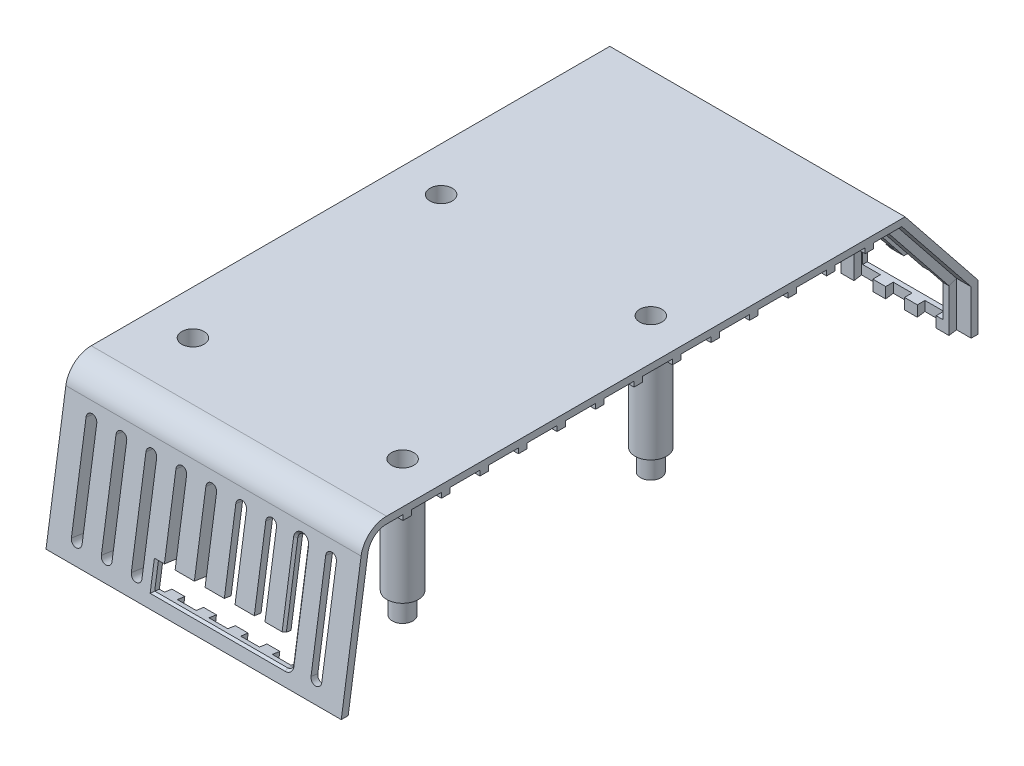
from build123d import *
from OCP.BRepFilletAPI import BRepFilletAPI_MakeChamfer

# Parameters (mm, degrees)
EXTRUDE_1_DEPTH      = 69
SKETCH_7_W           = 3
SKETCH_7_H           = 1.8
SKETCH_18_R          = 3.7
EXTRUDE_2_DEPTH      = 30
EXTRUDE_START        = -69
SKETCH_28_W          = 2
SKETCH_28_H          = 1.2
EXTRUDE_3_DEPTH      = 69
SKETCH_27_R          = 2.6
CUT_EXTRUDE_6_DEPTH  = 25
CUT_EXTRUDE_7_REACH  = 169.39
SKETCH_29_R          = 1.35
SKETCH_30_R          = 4
SKETCH_30_R_2        = 2.4
CUT_EXTRUDE_8_DEPTH  = 5
CUT_EXTRUDE_9_REACH  = 177.052
CUT_EXTRUDE_10_REACH = 164.542
CUT_EXTRUDE_START    = -3.379506
SKETCH_33_W          = 31.085842881
SKETCH_33_H          = 6.2
CUT_EXTRUDE_11_DEPTH = 3.379506
CUT_EXTRUDE_12_REACH = 170.6
SKETCH_34_W          = 20.5
SKETCH_34_H          = 11.5
CHAMFER_1_SIZE       = 0.5
CHAMFER_1_SIZE2      = 0.355745443


with BuildPart() as part:
    # 草图2 → 凸台-拉伸1 (new body)
    with BuildSketch(Plane(origin=(0, 0, 0), x_dir=(0, 0, -1), z_dir=(1, 0, 0))):
        with BuildLine():
            Line((-2.001625282, 6.75), (-2.001625282, 17.164444968))
            Line((-2.001625282, 17.164444968), (-18.214026207, 37.447074334))
            Line((-18.214026207, 37.447074334), (-138.628938569, 37.447074334))
            ThreePointArc((-138.628938569, 37.447074334), (-141.499289796, 36.38190324), (-142.979906861, 33.70211244))
            Line((-142.979906861, 33.70211244), (-147.037546338, 6.75))
            Line((-147.037546338, 6.75), (-147.579526198, 3.15))
            Line((-147.579526198, 3.15), (-149.197556836, 3.15))
            Line((-149.197556836, 3.15), (-148.655576976, 6.75))
            Line((-148.655576976, 6.75), (-144.562077149, 33.940308116))
            ThreePointArc((-144.562077149, 33.940308116), (-142.543053879, 37.594568297), (-138.628938569, 39.047074334))
            Line((-138.628938569, 39.047074334), (-17.444620599, 39.047074334))
            Line((-17.444620599, 39.047074334), (-0.401625282, 17.725324466))
            Line((-0.401625282, 17.725324466), (-0.401625282, 6.75))
            Line((-0.401625282, 6.75), (-2.001625282, 6.75))
        make_face()
    extrude(amount=EXTRUDE_1_DEPTH)

    # 扫描1: sweep along a path in 草图17
    with BuildLine(Plane.ZY) as sweep_1_path:
        Line((147.579526198, 3.15), (143.056789207, 33.191435819))
        ThreePointArc((143.056789207, 33.191435819), (141.374269815, 36.236652636), (138.112507057, 37.447074334))
        Line((138.112507057, 37.447074334), (18.214026207, 37.447074334))
        Line((18.214026207, 37.447074334), (2.001625282, 17.164444968))
        Line((2.001625282, 17.164444968), (2.001625282, 6.75))
    # 草图7 → 扫描1 (sweep)
    with BuildSketch(Plane.XZ.offset(-3.15)):
        with Locations((34.5, 146.679966657)):
            Rectangle(SKETCH_7_W, SKETCH_7_H)
        with Locations((27.1, 146.679966657)):
            Rectangle(SKETCH_7_W, SKETCH_7_H)
        with Locations((19.7, 146.679966657)):
            Rectangle(SKETCH_7_W, SKETCH_7_H)
        with Locations((12.3, 146.679966657)):
            Rectangle(SKETCH_7_W, SKETCH_7_H)
        with Locations((4.9, 146.679966657)):
            Rectangle(SKETCH_7_W, SKETCH_7_H)
        with Locations((41.9, 146.679966657)):
            Rectangle(SKETCH_7_W, SKETCH_7_H)
        with Locations((49.3, 146.679966657)):
            Rectangle(SKETCH_7_W, SKETCH_7_H)
        with Locations((56.7, 146.679966657)):
            Rectangle(SKETCH_7_W, SKETCH_7_H)
        with Locations((64.1, 146.679966657)):
            Rectangle(SKETCH_7_W, SKETCH_7_H)
    sweep(path=sweep_1_path.line, transition=Transition.RIGHT)

    # 草图18 → 凸台-拉伸2 (add)
    with BuildSketch(Plane.XZ.offset(-37.447074334)):
        with Locations(Location((59.3, 67.161625282, 0), (0, 0, 107.295344629))):
            Circle(SKETCH_18_R)
        with Locations(Location((59.3, 125.161625282, 0), (0, 0, 107.295344629))):
            Circle(SKETCH_18_R)
        with Locations(Location((10.3, 125.161625282, 0), (0, 0, 82.233565831))):
            Circle(SKETCH_18_R)
        with Locations(Location((10.3, 67.161625282, 0), (0, 0, 82.233565831))):
            Circle(SKETCH_18_R)
    extrude(amount=EXTRUDE_2_DEPTH)

    # 草图28 → 凸台-拉伸3 (add)
    with BuildSketch(Plane(origin=(69, 0, 0), x_dir=(0, 0, -1), z_dir=(1, 0, 0)).offset(EXTRUDE_START)):
        with Locations((-133.786467665, 36.847074334)):
            Rectangle(SKETCH_28_W, SKETCH_28_H)
        with Locations((-124.786467665, 36.847074334)):
            Rectangle(SKETCH_28_W, SKETCH_28_H)
        with Locations((-115.786467665, 36.847074334)):
            Rectangle(SKETCH_28_W, SKETCH_28_H)
        with Locations((-106.786467665, 36.847074334)):
            Rectangle(SKETCH_28_W, SKETCH_28_H)
        with Locations((-97.786467665, 36.847074334)):
            Rectangle(SKETCH_28_W, SKETCH_28_H)
        with Locations((-88.786467665, 36.847074334)):
            Rectangle(SKETCH_28_W, SKETCH_28_H)
        with Locations((-79.786467665, 36.847074334)):
            Rectangle(SKETCH_28_W, SKETCH_28_H)
        with Locations((-70.786467665, 36.847074334)):
            Rectangle(SKETCH_28_W, SKETCH_28_H)
        with Locations((-61.786467665, 36.847074334)):
            Rectangle(SKETCH_28_W, SKETCH_28_H)
        with Locations((-52.786467665, 36.847074334)):
            Rectangle(SKETCH_28_W, SKETCH_28_H)
        with Locations((-43.786467665, 36.847074334)):
            Rectangle(SKETCH_28_W, SKETCH_28_H)
        with Locations((-34.786467665, 36.847074334)):
            Rectangle(SKETCH_28_W, SKETCH_28_H)
        with Locations((-25.786467665, 36.847074334)):
            Rectangle(SKETCH_28_W, SKETCH_28_H)
    extrude(amount=EXTRUDE_3_DEPTH)

    # 草图27 → 切除-拉伸6 (cut)
    with BuildSketch(Plane(origin=(0, 39.047074334, 0), x_dir=(1, 0, 0), z_dir=(0, 1, 0))):
        with Locations(Location((10.3, -67.161625282, 0), (0, 0, 270))):
            Circle(SKETCH_27_R)
        with Locations(Location((59.3, -125.161625282, 0), (0, 0, 270))):
            Circle(SKETCH_27_R)
        with Locations(Location((10.3, -125.161625282, 0), (0, 0, 270))):
            Circle(SKETCH_27_R)
        with Locations(Location((59.3, -67.161625282, 0), (0, 0, 270))):
            Circle(SKETCH_27_R)
    extrude(amount=-CUT_EXTRUDE_6_DEPTH, mode=Mode.SUBTRACT)

    # 草图29 → 切除-拉伸7 (cut, up to next)
    with BuildSketch(Plane.XZ.offset(-7.447074334), mode=Mode.PRIVATE) as cut_extrude_7_sk1:
        with Locations(Location((59.3, 67.161625282, 0), (0, 0, 270))):
            Circle(SKETCH_29_R)
    cut_extrude_7_tool1 = extrude(cut_extrude_7_sk1.sketch, amount=-CUT_EXTRUDE_7_REACH, mode=Mode.PRIVATE) & part.part
    # 草图29 → 切除-拉伸7 (cut, up to next)
    with BuildSketch(Plane.XZ.offset(-7.447074334), mode=Mode.PRIVATE) as cut_extrude_7_sk2:
        with Locations(Location((10.3, 67.161625282, 0), (0, 0, 270))):
            Circle(SKETCH_29_R)
    cut_extrude_7_tool2 = extrude(cut_extrude_7_sk2.sketch, amount=-CUT_EXTRUDE_7_REACH, mode=Mode.PRIVATE) & part.part
    # 草图29 → 切除-拉伸7 (cut, up to next)
    with BuildSketch(Plane.XZ.offset(-7.447074334), mode=Mode.PRIVATE) as cut_extrude_7_sk3:
        with Locations(Location((10.3, 125.161625282, 0), (0, 0, 270))):
            Circle(SKETCH_29_R)
    cut_extrude_7_tool3 = extrude(cut_extrude_7_sk3.sketch, amount=-CUT_EXTRUDE_7_REACH, mode=Mode.PRIVATE) & part.part
    # 草图29 → 切除-拉伸7 (cut, up to next)
    with BuildSketch(Plane.XZ.offset(-7.447074334), mode=Mode.PRIVATE) as cut_extrude_7_sk4:
        with Locations(Location((59.3, 125.161625282, 0), (0, 0, 270))):
            Circle(SKETCH_29_R)
    cut_extrude_7_tool4 = extrude(cut_extrude_7_sk4.sketch, amount=-CUT_EXTRUDE_7_REACH, mode=Mode.PRIVATE) & part.part
    add(cut_extrude_7_tool1.solids().sort_by_distance((59.3, 7.447074, 67.161625))[0], mode=Mode.SUBTRACT)
    add(cut_extrude_7_tool2.solids().sort_by_distance((10.3, 7.447074, 67.161625))[0], mode=Mode.SUBTRACT)
    add(cut_extrude_7_tool3.solids().sort_by_distance((10.3, 7.447074, 125.161625))[0], mode=Mode.SUBTRACT)
    add(cut_extrude_7_tool4.solids().sort_by_distance((59.3, 7.447074, 125.161625))[0], mode=Mode.SUBTRACT)

    # 草图30 → 切除-拉伸8 (cut)
    # profile 1 of 4: a face of its own
    with BuildSketch(Plane.XZ.offset(-7.447074334)):
        with Locations((59.3, 67.161625282)):
            Circle(SKETCH_30_R)
        with Locations(Location((59.3, 67.161625282, 0), (0, 0, 270))):
            Circle(SKETCH_30_R_2, mode=Mode.SUBTRACT)
    # profile 2 of 4: a face of its own
    with BuildSketch(Plane.XZ.offset(-7.447074334)):
        with Locations((10.3, 67.161625282)):
            Circle(SKETCH_30_R)
        with Locations(Location((10.3, 67.161625282, 0), (0, 0, 270))):
            Circle(SKETCH_30_R_2, mode=Mode.SUBTRACT)
    # profile 3 of 4: a face of its own
    with BuildSketch(Plane.XZ.offset(-7.447074334)):
        with Locations((10.3, 125.161625282)):
            Circle(SKETCH_30_R)
        with Locations(Location((10.3, 125.161625282, 0), (0, 0, 270))):
            Circle(SKETCH_30_R_2, mode=Mode.SUBTRACT)
    # profile 4 of 4: a face of its own
    with BuildSketch(Plane.XZ.offset(-7.447074334)):
        with Locations((59.3, 125.161625282)):
            Circle(SKETCH_30_R)
        with Locations(Location((59.3, 125.161625282, 0), (0, 0, 270))):
            Circle(SKETCH_30_R_2, mode=Mode.SUBTRACT)
    extrude(amount=-CUT_EXTRUDE_8_DEPTH, mode=Mode.SUBTRACT)

    # 草图31 → 切除-拉伸9 (cut, up to next)
    with BuildSketch(Plane(origin=(0, 6.714196053, -8.399838534), x_dir=(-1, 0, 0), z_dir=(0, 0.624373217491497, -0.7811261647642562)), mode=Mode.PRIVATE) as cut_extrude_9_sk1:
        Polygon((-56.770892384, 34.156163026), (-54.232430846, 34.156163026), (-51.725219307, 30.302797642), (-49.213200076, 34.156163026), (-46.672334692, 34.156163026), (-50.455988538, 28.353278411), (-46.422334692, 22.156163026), (-48.96079623, 22.156163026), (-51.725219307, 26.406163026), (-54.496853923, 22.156163026), (-57.037719307, 22.156163026), (-52.994450076, 28.355682257), align=None)
    cut_extrude_9_tool1 = extrude(cut_extrude_9_sk1.sketch, amount=-CUT_EXTRUDE_9_REACH, mode=Mode.PRIVATE) & part.part
    # 草图31 → 切除-拉伸9 (cut, up to next)
    with BuildSketch(Plane(origin=(0, 6.714196053, -8.399838534), x_dir=(-1, 0, 0), z_dir=(0, 0.624373217491497, -0.7811261647642562)), mode=Mode.PRIVATE) as cut_extrude_9_sk2:
        Polygon((-39.24204623, 34.156163026), (-37.006469307, 34.156163026), (-34.268488538, 25.785970719), (-31.511277, 34.156163026), (-29.297334692, 34.156163026), (-27.268488538, 22.156163026), (-29.448777, 22.156163026), (-30.730027, 29.735489949), (-33.225219307, 22.156163026), (-35.326180846, 22.156163026), (-37.806950076, 29.735489949), (-39.08579623, 22.156163026), (-41.268488538, 22.156163026), align=None)
    cut_extrude_9_tool2 = extrude(cut_extrude_9_sk2.sketch, amount=-CUT_EXTRUDE_9_REACH, mode=Mode.PRIVATE) & part.part
    # 草图31 → 切除-拉伸9 (cut, up to next)
    with BuildSketch(Plane(origin=(0, 6.714196053, -8.399838534), x_dir=(-1, 0, 0), z_dir=(0, 0.624373217491497, -0.7811261647642562)), mode=Mode.PRIVATE) as cut_extrude_9_sk3:
        with BuildLine():
            Line((-20.653103923, 34.156163026), (-18.499257769, 34.156163026))
            Line((-18.499257769, 34.156163026), (-18.499257769, 26.348470719))
            add(Edge.make_bspline(
                [(-18.499257769, 26.348470719), (-18.499140653, 26.267523951), (-18.498914446, 26.111176106), (-18.487590384, 25.886868138), (-18.477228086, 25.680682149), (-18.458531559, 25.492843871), (-18.430910381, 25.323272952), (-18.404164068, 25.170880129), (-18.367965578, 25.038393824), (-18.313565035, 24.887589722), (-18.229751655, 24.718153077), (-18.092805244, 24.541562319), (-17.934780801, 24.380397621), (-17.745379404, 24.246250232), (-17.532508984, 24.137737086), (-17.29733917, 24.057340854), (-17.040201466, 24.012651223), (-16.862404849, 24.005828532), (-16.770892384, 24.002316872)],
                knots=[0, 0, 0, 0, 1.155499968, 2.231836252, 3.205919964, 4.102923608, 4.924856345, 5.658536265, 6.31071849, 6.882491295, 7.94666036, 8.992281882, 10.060072772, 11.158554251, 12.289267114, 13.461410017, 14.693379945, 16, 16, 16, 16], degree=3))
            add(Edge.make_bspline(
                [(-16.770892384, 24.002316872), (-16.673671684, 24.005153843), (-16.484107778, 24.010685455), (-16.211450278, 24.064984213), (-15.958831557, 24.151446433), (-15.731600417, 24.274850057), (-15.529982988, 24.422770926), (-15.359318059, 24.591447071), (-15.224629924, 24.781214917), (-15.136845208, 24.956290205), (-15.087558414, 25.117431762), (-15.050615506, 25.261405629), (-15.023532267, 25.43128054), (-14.998961463, 25.624403533), (-14.984196303, 25.842774989), (-14.968185894, 26.084638738), (-14.96231793, 26.351649676), (-14.961317779, 26.537574403), (-14.96079623, 26.634528411)],
                knots=[0, 0, 0, 0, 1.261321664, 2.459363699, 3.594844139, 4.716940403, 5.803436589, 6.833651888, 7.818396249, 8.814403945, 9.360733334, 10.004355033, 10.743453831, 11.592799886, 12.532235708, 13.585170094, 14.740740724, 16, 16, 16, 16], degree=3))
            Line((-14.96079623, 26.634528411), (-14.96079623, 34.156163026))
            Line((-14.96079623, 34.156163026), (-12.806950076, 34.156163026))
            Line((-12.806950076, 34.156163026), (-12.806950076, 26.99750918))
            add(Edge.make_bspline(
                [(-12.806950076, 26.99750918), (-12.807249177, 26.852475195), (-12.807824319, 26.573588987), (-12.816656757, 26.17280988), (-12.835459422, 25.806762454), (-12.851251491, 25.47533975), (-12.881814553, 25.17898825), (-12.913654094, 24.916442448), (-12.954236328, 24.688632747), (-13.014620253, 24.429299087), (-13.11882503, 24.130685876), (-13.286816792, 23.786845707), (-13.50007146, 23.450205355), (-13.752127821, 23.124468094), (-14.036722509, 22.821868677), (-14.34754545, 22.556225557), (-14.679658441, 22.331520122), (-15.036531824, 22.153246692), (-15.417861882, 22.014206856), (-15.827421591, 21.920779089), (-16.264931663, 21.857658117), (-16.56712814, 21.851594571), (-16.722815461, 21.848470719)],
                knots=[0, 0, 0, 0, 1.170808336, 2.251350247, 3.235597562, 4.129743112, 4.929140599, 5.639994148, 6.264258765, 6.79612947, 7.788252245, 8.809469599, 9.879094798, 10.999557536, 12.129761673, 13.226370002, 14.293821979, 15.358369427, 16.438775801, 17.562147481, 18.744053101, 20, 20, 20, 20], degree=3))
            add(Edge.make_bspline(
                [(-16.722815461, 21.848470719), (-16.826257214, 21.850213058), (-17.030345672, 21.853650659), (-17.330493552, 21.883961316), (-17.620645438, 21.928627827), (-17.900256137, 21.993791668), (-18.170296126, 22.077971179), (-18.430693662, 22.181590294), (-18.680481044, 22.30407104), (-18.918260496, 22.444286859), (-19.143739412, 22.595906129), (-19.349815502, 22.763982472), (-19.543580328, 22.936086008), (-19.719436106, 23.119459585), (-19.878703668, 23.312178092), (-20.021055003, 23.514678292), (-20.146278625, 23.7269422), (-20.257524464, 23.952795859), (-20.352740045, 24.203718596), (-20.433010356, 24.488635835), (-20.50313639, 24.812013371), (-20.55524992, 25.174579754), (-20.602496352, 25.575140008), (-20.632400739, 26.014737651), (-20.64804507, 26.493385298), (-20.651375029, 26.825221789), (-20.653103923, 26.99750918)],
                knots=[0, 0, 0, 0, 1.001158378, 1.975264943, 2.917723546, 3.841610987, 4.75185031, 5.653588123, 6.552117133, 7.442167995, 8.324307438, 9.179605724, 10.014504199, 10.831958861, 11.636465792, 12.43274043, 13.225645099, 14.020104002, 14.867201867, 15.819789774, 16.883317127, 18.068162734, 19.364263498, 20.787406516, 22.332041935, 24, 24, 24, 24], degree=3))
            Line((-20.653103923, 26.99750918), (-20.653103923, 34.156163026))
        make_face()
    cut_extrude_9_tool3 = extrude(cut_extrude_9_sk3.sketch, amount=-CUT_EXTRUDE_9_REACH, mode=Mode.PRIVATE) & part.part
    add(cut_extrude_9_tool1.solids().sort_by_distance((51.725705, 28.694008, 9.169162))[0], mode=Mode.SUBTRACT)
    add(cut_extrude_9_tool2.solids().sort_by_distance((38.124258, 33.250436, 12.811226))[0], mode=Mode.SUBTRACT)
    add(cut_extrude_9_tool3.solids().sort_by_distance((19.576181, 33.280456, 12.835222))[0], mode=Mode.SUBTRACT)

    # 草图32 → 切除-拉伸10 (cut, up to next)
    with BuildSketch(Plane(origin=(0, 22.033682216, 146.354619214), x_dir=(1, 0, 0), z_dir=(0, 0.14887229698271995, 0.9888564300195903)), mode=Mode.PRIVATE) as cut_extrude_10_sk1:
        with BuildLine():
            Line((35.75, 8.5), (35.75, -14.5))
            ThreePointArc((35.75, -14.5), (34.5, -15.75), (33.25, -14.5))
            Line((33.25, -14.5), (33.25, 8.5))
            ThreePointArc((33.25, 8.5), (34.5, 9.75), (35.75, 8.5))
        make_face()
    cut_extrude_10_tool1 = extrude(cut_extrude_10_sk1.sketch, amount=-CUT_EXTRUDE_10_REACH, mode=Mode.PRIVATE) & part.part
    # 草图32 → 切除-拉伸10 (cut, up to next)
    with BuildSketch(Plane(origin=(0, 22.033682216, 146.354619214), x_dir=(1, 0, 0), z_dir=(0, 0.14887229698271995, 0.9888564300195903)), mode=Mode.PRIVATE) as cut_extrude_10_sk2:
        with BuildLine():
            Line((42.75, 8.5), (42.75, -14.5))
            ThreePointArc((42.75, -14.5), (41.5, -15.75), (40.25, -14.5))
            Line((40.25, -14.5), (40.25, 8.5))
            ThreePointArc((40.25, 8.5), (41.5, 9.75), (42.75, 8.5))
        make_face()
    cut_extrude_10_tool2 = extrude(cut_extrude_10_sk2.sketch, amount=-CUT_EXTRUDE_10_REACH, mode=Mode.PRIVATE) & part.part
    # 草图32 → 切除-拉伸10 (cut, up to next)
    with BuildSketch(Plane(origin=(0, 22.033682216, 146.354619214), x_dir=(1, 0, 0), z_dir=(0, 0.14887229698271995, 0.9888564300195903)), mode=Mode.PRIVATE) as cut_extrude_10_sk3:
        with BuildLine():
            Line((49.75, 8.5), (49.75, -14.5))
            ThreePointArc((49.75, -14.5), (48.5, -15.75), (47.25, -14.5))
            Line((47.25, -14.5), (47.25, 8.5))
            ThreePointArc((47.25, 8.5), (48.5, 9.75), (49.75, 8.5))
        make_face()
    cut_extrude_10_tool3 = extrude(cut_extrude_10_sk3.sketch, amount=-CUT_EXTRUDE_10_REACH, mode=Mode.PRIVATE) & part.part
    # 草图32 → 切除-拉伸10 (cut, up to next)
    with BuildSketch(Plane(origin=(0, 22.033682216, 146.354619214), x_dir=(1, 0, 0), z_dir=(0, 0.14887229698271995, 0.9888564300195903)), mode=Mode.PRIVATE) as cut_extrude_10_sk4:
        with BuildLine():
            Line((56.75, 8.5), (56.75, -14.5))
            ThreePointArc((56.75, -14.5), (55.5, -15.75), (54.25, -14.5))
            Line((54.25, -14.5), (54.25, 8.5))
            ThreePointArc((54.25, 8.5), (55.5, 9.75), (56.75, 8.5))
        make_face()
    cut_extrude_10_tool4 = extrude(cut_extrude_10_sk4.sketch, amount=-CUT_EXTRUDE_10_REACH, mode=Mode.PRIVATE) & part.part
    # 草图32 → 切除-拉伸10 (cut, up to next)
    with BuildSketch(Plane(origin=(0, 22.033682216, 146.354619214), x_dir=(1, 0, 0), z_dir=(0, 0.14887229698271995, 0.9888564300195903)), mode=Mode.PRIVATE) as cut_extrude_10_sk5:
        with BuildLine():
            Line((63.75, 8.5), (63.75, -14.5))
            ThreePointArc((63.75, -14.5), (62.5, -15.75), (61.25, -14.5))
            Line((61.25, -14.5), (61.25, 8.5))
            ThreePointArc((61.25, 8.5), (62.5, 9.75), (63.75, 8.5))
        make_face()
    cut_extrude_10_tool5 = extrude(cut_extrude_10_sk5.sketch, amount=-CUT_EXTRUDE_10_REACH, mode=Mode.PRIVATE) & part.part
    # 草图32 → 切除-拉伸10 (cut, up to next)
    with BuildSketch(Plane(origin=(0, 22.033682216, 146.354619214), x_dir=(1, 0, 0), z_dir=(0, 0.14887229698271995, 0.9888564300195903)), mode=Mode.PRIVATE) as cut_extrude_10_sk6:
        with BuildLine():
            Line((28.75, 8.5), (28.75, -14.5))
            ThreePointArc((28.75, -14.5), (27.5, -15.75), (26.25, -14.5))
            Line((26.25, -14.5), (26.25, 8.5))
            ThreePointArc((26.25, 8.5), (27.5, 9.75), (28.75, 8.5))
        make_face()
    cut_extrude_10_tool6 = extrude(cut_extrude_10_sk6.sketch, amount=-CUT_EXTRUDE_10_REACH, mode=Mode.PRIVATE) & part.part
    # 草图32 → 切除-拉伸10 (cut, up to next)
    with BuildSketch(Plane(origin=(0, 22.033682216, 146.354619214), x_dir=(1, 0, 0), z_dir=(0, 0.14887229698271995, 0.9888564300195903)), mode=Mode.PRIVATE) as cut_extrude_10_sk7:
        with BuildLine():
            Line((21.75, 8.5), (21.75, -14.5))
            ThreePointArc((21.75, -14.5), (20.5, -15.75), (19.25, -14.5))
            Line((19.25, -14.5), (19.25, 8.5))
            ThreePointArc((19.25, 8.5), (20.5, 9.75), (21.75, 8.5))
        make_face()
    cut_extrude_10_tool7 = extrude(cut_extrude_10_sk7.sketch, amount=-CUT_EXTRUDE_10_REACH, mode=Mode.PRIVATE) & part.part
    # 草图32 → 切除-拉伸10 (cut, up to next)
    with BuildSketch(Plane(origin=(0, 22.033682216, 146.354619214), x_dir=(1, 0, 0), z_dir=(0, 0.14887229698271995, 0.9888564300195903)), mode=Mode.PRIVATE) as cut_extrude_10_sk8:
        with BuildLine():
            Line((14.75, 8.5), (14.75, -14.5))
            ThreePointArc((14.75, -14.5), (13.5, -15.75), (12.25, -14.5))
            Line((12.25, -14.5), (12.25, 8.5))
            ThreePointArc((12.25, 8.5), (13.5, 9.75), (14.75, 8.5))
        make_face()
    cut_extrude_10_tool8 = extrude(cut_extrude_10_sk8.sketch, amount=-CUT_EXTRUDE_10_REACH, mode=Mode.PRIVATE) & part.part
    # 草图32 → 切除-拉伸10 (cut, up to next)
    with BuildSketch(Plane(origin=(0, 22.033682216, 146.354619214), x_dir=(1, 0, 0), z_dir=(0, 0.14887229698271995, 0.9888564300195903)), mode=Mode.PRIVATE) as cut_extrude_10_sk9:
        with BuildLine():
            Line((7.75, 8.5), (7.75, -14.5))
            ThreePointArc((7.75, -14.5), (6.5, -15.75), (5.25, -14.5))
            Line((5.25, -14.5), (5.25, 8.5))
            ThreePointArc((5.25, 8.5), (6.5, 9.75), (7.75, 8.5))
        make_face()
    cut_extrude_10_tool9 = extrude(cut_extrude_10_sk9.sketch, amount=-CUT_EXTRUDE_10_REACH, mode=Mode.PRIVATE) & part.part
    add(cut_extrude_10_tool1.solids().sort_by_distance((34.5, 19.067113, 146.801236))[0], mode=Mode.SUBTRACT)
    add(cut_extrude_10_tool2.solids().sort_by_distance((41.5, 19.067113, 146.801236))[0], mode=Mode.SUBTRACT)
    add(cut_extrude_10_tool3.solids().sort_by_distance((48.5, 19.067113, 146.801236))[0], mode=Mode.SUBTRACT)
    add(cut_extrude_10_tool4.solids().sort_by_distance((55.5, 19.067113, 146.801236))[0], mode=Mode.SUBTRACT)
    add(cut_extrude_10_tool5.solids().sort_by_distance((62.5, 19.067113, 146.801236))[0], mode=Mode.SUBTRACT)
    add(cut_extrude_10_tool6.solids().sort_by_distance((27.5, 19.067113, 146.801236))[0], mode=Mode.SUBTRACT)
    add(cut_extrude_10_tool7.solids().sort_by_distance((20.5, 19.067113, 146.801236))[0], mode=Mode.SUBTRACT)
    add(cut_extrude_10_tool8.solids().sort_by_distance((13.5, 19.067113, 146.801236))[0], mode=Mode.SUBTRACT)
    add(cut_extrude_10_tool9.solids().sort_by_distance((6.5, 19.067113, 146.801236))[0], mode=Mode.SUBTRACT)

    # 草图33 → 切除-拉伸11 (cut)
    with BuildSketch(Plane(origin=(0, 22.033682216, 146.354619214), x_dir=(1, 0, 0), z_dir=(0, 0.14887229698271995, 0.9888564300195903)).offset(CUT_EXTRUDE_START)):
        with Locations((39.95707856, -12.65)):
            Rectangle(SKETCH_33_W, SKETCH_33_H)
    extrude(amount=CUT_EXTRUDE_11_DEPTH, mode=Mode.SUBTRACT)

    # 草图34 → 切除-拉伸12 (cut, up to next)
    with BuildSketch(Plane(origin=(0, 0, 0.401625282), x_dir=(-1, 0, 0), z_dir=(0, 0, -1)), mode=Mode.PRIVATE) as cut_extrude_12_sk1:
        with Locations((-53.9, 14.75)):
            Rectangle(SKETCH_34_W, SKETCH_34_H)
    cut_extrude_12_tool1 = extrude(cut_extrude_12_sk1.sketch, amount=-CUT_EXTRUDE_12_REACH, mode=Mode.PRIVATE) & part.part
    add(cut_extrude_12_tool1.solids().sort_by_distance((53.9, 14.75, 0.401625))[0], mode=Mode.SUBTRACT)

    # 倒角1: one chamfer whose edges measure the first distance from different faces: ONE call of the kernel's chamfer builder (chamfer() names one face for all edges)
    chamfer_1_edges_1 = [part.edges().sort_by_distance(p)[0] for p in [
        (55.5, 31.675032409, 144.903114319),
        (54.25, 21.51453259, 146.43277717),
        (56.75, 19.067112926, 146.801236105),
        (24.414157119, 9.524648376, 148.237853771),
        (39.957078559, 6.459193443, 148.699357892),
        (56.383883476, 6.821230122, 148.644853284),
        (43.65, 13.362662233, 0.401625282),
        (64.15, 13.362662233, 0.401625282),
        (53.9, 9, 0.401625282),
        (64.15, 19.112662233, 1.510558236),
        (43.65, 19.112662233, 1.510558236),
    ]]
    chamfer_1_edges_2 = [part.edges().sort_by_distance(p)[0] for p in [
        (53.9, 20.5, 2.61949119),
    ]]
    chamfer_1_side_2 = [part.faces().sort_by_distance(p)[0] for p in [
        (33.648741969, 28.7866092, 9.243180271),
    ]]
    chamfer_1 = BRepFilletAPI_MakeChamfer(part.part.solid().wrapped)
    for e in chamfer_1_edges_1:
        chamfer_1.Add(CHAMFER_1_SIZE, e.wrapped)
    for e in chamfer_1_edges_2:
        chamfer_1.Add(CHAMFER_1_SIZE, CHAMFER_1_SIZE2, e.wrapped, chamfer_1_side_2[0].wrapped)  # the first distance lies on this face
    add(Compound.cast(chamfer_1.Shape()), mode=Mode.REPLACE)


solid = part.part
